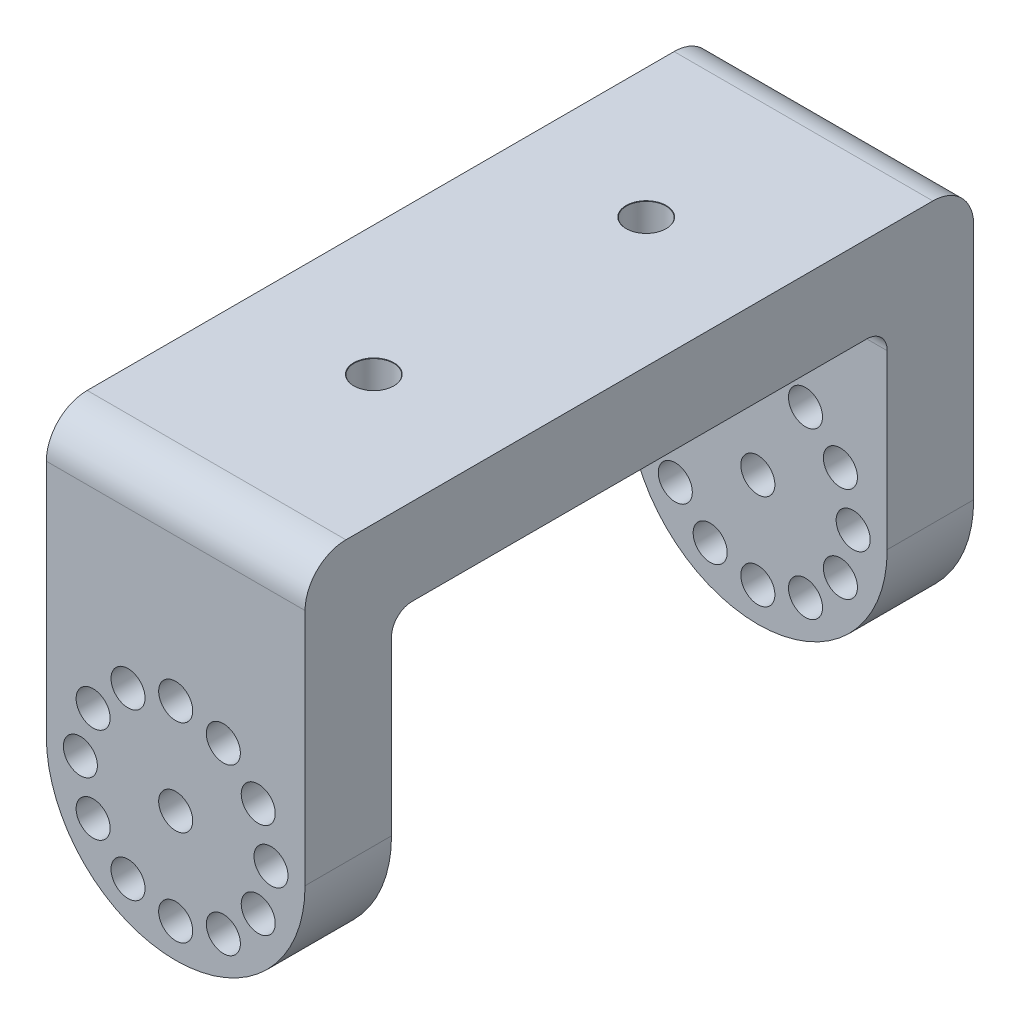
from build123d import *
from OCP.BRepFilletAPI import BRepFilletAPI_MakeFillet

# Parameters (mm, degrees)
BOSS_EXTRUDE1_DEPTH                            = 19
FILLET1_R                                      = 9.5
F_2_5MM_DOWEL_HOLE1_D                          = 2.5
CIRPATTERN1_COUNT                              = 12
FILLET2_R1                                     = 3
FILLET2_R2                                     = 1.5
F_2_5MM_DOWEL_HOLE2_D                          = 2.5
CSK_FOR_M2_5_FLAT_HEAD_MACHINE_SCREW1_AT_COUNT = 2
CSK_FOR_M2_5_FLAT_HEAD_MACHINE_SCREW1_AT_PITCH = 20


with BuildPart() as part:
    # Sketch16 → Boss-Extrude1 (new body)
    with BuildSketch(Plane(origin=(0, 0, 0), x_dir=(0, 0, -1), z_dir=(1, 0, 0))):
        Polygon((0, 0), (-49.1, 0), (-49.1, -30), (-42.75, -30), (-42.75, -6.35), (-6.35, -6.35), (-6.35, -30), (0, -30), align=None)
    extrude(amount=BOSS_EXTRUDE1_DEPTH)

    # Fillet1
    fillet1_edges = [part.edges().sort_by_distance(p)[0] for p in [
        (19, -30, 3.175),
        (0, -30, 3.175),
        (0, -30, 45.925),
        (19, -30, 45.925),
    ]]
    fillet(fillet1_edges, radius=FILLET1_R - 0.0001)  # a hair under: the kernel refuses the full size

    # Ø2.5mm Dowel Hole1 (through all)
    with Locations(Plane.XY.offset(49.1)):
        with Locations((9.5, -13.5)):
            f_2_5mm_dowel_hole1 = Hole(F_2_5MM_DOWEL_HOLE1_D / 2)

    # CirPattern1: Ø2.5mm Dowel Hole1 ×12 about axis
    cirpattern1_axis = Axis((9.5, -20.5, 0), (0, 0, 1))
    for i in range(1, CIRPATTERN1_COUNT):
        add(f_2_5mm_dowel_hole1.rotate(cirpattern1_axis, i * 360 / CIRPATTERN1_COUNT), mode=Mode.SUBTRACT)

    # Fillet2: one fillet with a radius per group of edges: ONE call of the kernel's fillet builder (fillet() takes one radius for all edges)
    fillet2_edges_1 = [part.edges().sort_by_distance(p)[0] for p in [
        (9.5, 0, 49.1),
        (9.5, 0, 0),
    ]]
    fillet2_edges_2 = [part.edges().sort_by_distance(p)[0] for p in [
        (9.5, -6.35, 42.75),
        (9.5, -6.35, 6.35),
    ]]
    fillet2 = BRepFilletAPI_MakeFillet(part.part.solid().wrapped)
    for e in fillet2_edges_1:
        fillet2.Add(FILLET2_R1, e.wrapped)
    for e in fillet2_edges_2:
        fillet2.Add(FILLET2_R2, e.wrapped)
    add(Compound.cast(fillet2.Shape()), mode=Mode.REPLACE)

    # Ø2.5mm Dowel Hole2 (through all)
    with Locations(Plane.XY.offset(49.1)):
        with Locations((9.5, -20.5)):
            Hole(F_2_5MM_DOWEL_HOLE2_D / 2)

    # Sketch28 → CSK for M2.5 Flat Head Machine Screw1 (revolve, cut)
    with BuildSketch(Plane(origin=(9.5, -6.35, 34.55), x_dir=(0, 0, -1), z_dir=(1, 0, 0))):
        Polygon((0, 0), (0, 6.35), (1.475, 6.35), (1.45, 6.325), (1.45, 1.3), (2.75, 0), align=None)
    csk_for_m2_5_flat_head_machine_screw1 = revolve(axis=Axis((9.5, -12.7, 34.55), (0, 1, 0)), mode=Mode.SUBTRACT)

    # CSK for M2.5 Flat Head Machine Screw1 at: CSK for M2.5 Flat Head Machine Screw1 ×2
    with Locations(*[(0, 0, -i * CSK_FOR_M2_5_FLAT_HEAD_MACHINE_SCREW1_AT_PITCH) for i in range(1, CSK_FOR_M2_5_FLAT_HEAD_MACHINE_SCREW1_AT_COUNT)]):
        add(csk_for_m2_5_flat_head_machine_screw1, mode=Mode.SUBTRACT)


solid = part.part
